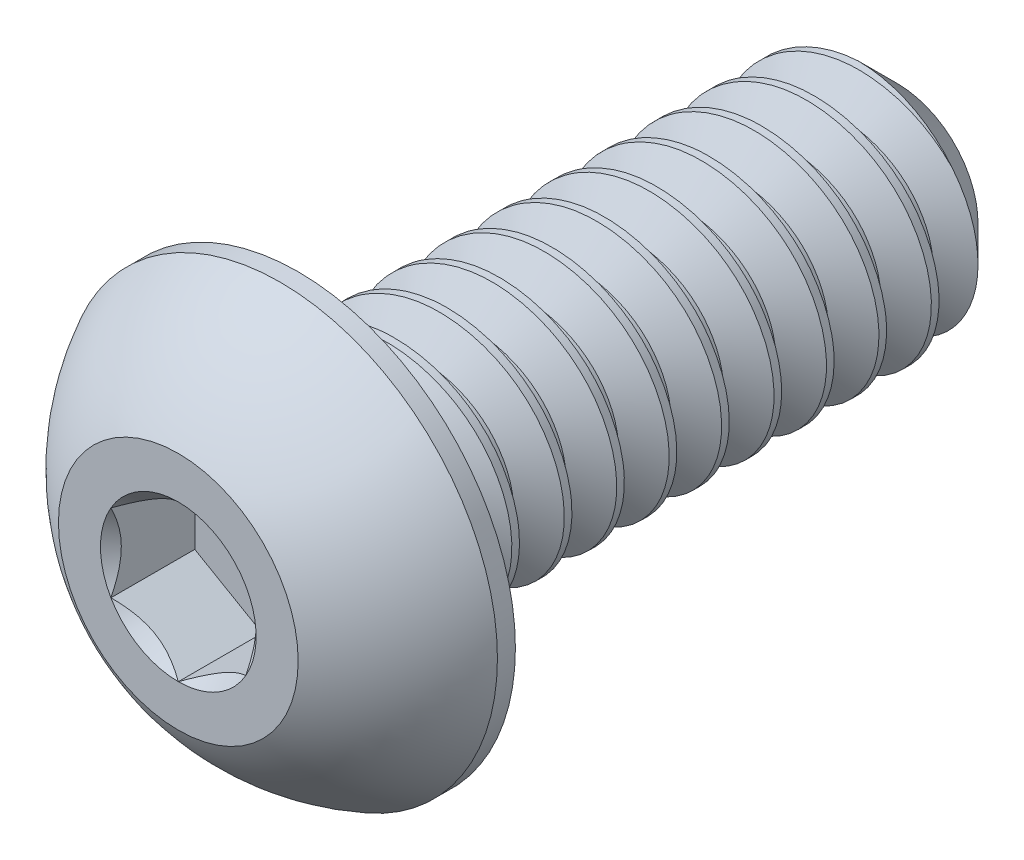
from build123d import *

# Parameters (mm, degrees)
SKETCH1_W          = 4
SKETCH1_H          = 0.8
CHAMFER1_SIZE      = 0.2625
CUT_EXTRUDE2_DEPTH = 0.56
CUT_SWEEP1_PITCH   = 0.35


with BuildPart() as part:
    # Sketch1 → Revolve1 (revolve)
    with BuildSketch(Plane(origin=(0, 0, 0), x_dir=(0, 0, -1), z_dir=(1, 0, 0))):
        with Locations((2.8, 0.4)):
            Rectangle(SKETCH1_W, SKETCH1_H)
    revolve(axis=Axis((0, 0, -4.8), (0, 0, 1)))

    # Chamfer1
    chamfer1_edges = [part.edges().sort_by_distance(p)[0] for p in [
        (0, -0.8, -4.8),
    ]]
    chamfer(chamfer1_edges, length=CHAMFER1_SIZE)

    # Sketch7 → Revolve2 (revolve)
    with BuildSketch(Plane(origin=(0, 0, 0), x_dir=(0, 0, -1), z_dir=(1, 0, 0)), mode=Mode.PRIVATE) as revolve2_sk:
        with BuildLine():
            Line((0.68, 1.45), (0.8, 1.45))
            Line((0.8, 1.45), (0.8, 0))
            Line((0.8, 0), (0, 0))
            Line((0, 0), (0, 0.8))
            ThreePointArc((0, 0.8), (0.291961854, 1.175255291), (0.68, 1.45))
        make_face()
    revolve(revolve2_sk.sketch.rotate(Axis((0, 0, 0), (0, 0, -1)), 180), axis=Axis((0, 0, 0), (0, 0, -1)))

    # Sketch5 → Cut-Extrude2 (cut)
    with BuildSketch(Plane.XY):
        Polygon((0.45, -0.259807621), (0.45, 0.259807621), (0, 0.519615242), (-0.45, 0.259807621), (-0.45, -0.259807621), (0, -0.519615242), align=None)
    extrude(amount=-CUT_EXTRUDE2_DEPTH, mode=Mode.SUBTRACT)

    # Cut-Extrude3 cone 1 section (through the dimple's axis) → Cut-Extrude3 (revolve, cut)
    with BuildSketch(Plane(origin=(0, 0, 0), x_dir=(0, -1, 0), z_dir=(1, 0, 0))):
        Polygon((0, 0), (0.519615242, 0), (0, 0.519615242), align=None)
    revolve(axis=Axis((0, 0, 0), (0, 0, -1)), mode=Mode.SUBTRACT)

    # Cut-Sweep1: the profile of Sketch2 profile screwed along a right-hand helix of 12.428571 turns, 6 arcs to a turn; built about Z, then put on its axis
    cut_sweep1_z = Axis((0, 0, 0), (0, 0, 1))
    cut_sweep1_corners = [(0.8003, 0, 0.262673205), (0.8003, 0, -0.036923205), (0.584792687, 0, 0.0875), (0.584792687, 0, 0.13825)]
    with BuildLine(mode=Mode.PRIVATE) as cut_sweep1_profile:
        Line(cut_sweep1_corners[0], cut_sweep1_corners[1])
        Line(cut_sweep1_corners[1], cut_sweep1_corners[2])
        Line(cut_sweep1_corners[2], cut_sweep1_corners[3])
        Line(cut_sweep1_corners[3], cut_sweep1_corners[0])
    cut_sweep1_cap = Face(cut_sweep1_profile.wire())
    cut_sweep1_turn_angles = [0, 30, 60, 90, 120, 150, 180, 210, 240, 270, 300, 330, 360]
    cut_sweep1_turn_weights = [1, 0.8660254037844387, 1, 0.8660254037844387, 1, 0.8660254037844387, 1, 0.8660254037844387, 1, 0.8660254037844387, 1, 0.8660254037844387, 1]
    cut_sweep1_turn_rails = [Edge.make_bspline([Vector(p[0], p[1], 0).rotate(cut_sweep1_z, cut_sweep1_turn_angles[k]) / cut_sweep1_turn_weights[k] + Vector(0, 0, p[2] + CUT_SWEEP1_PITCH * cut_sweep1_turn_angles[k] / 360) for k in range(13)], [0, 0, 0, 1, 1, 2, 2, 3, 3, 4, 4, 5, 5, 6, 6, 6], 2, cut_sweep1_turn_weights) for p in cut_sweep1_corners]
    cut_sweep1_turn_sides = [Face.make_surface_from_curves(cut_sweep1_turn_rails[p[0]], cut_sweep1_turn_rails[p[1]]) for p in [(0, 1), (1, 2), (2, 3), (3, 0)]]
    cut_sweep1_last_angles = [4320, 4350, 4380, 4410, 4440, 4457.142857143, 4474.285714286]
    cut_sweep1_last_weights = [1, 0.8660254037844387, 1, 0.8660254037844387, 1, 0.9555728057861187, 1]
    cut_sweep1_last_rails = [Edge.make_bspline([Vector(p[0], p[1], 0).rotate(cut_sweep1_z, cut_sweep1_last_angles[k]) / cut_sweep1_last_weights[k] + Vector(0, 0, p[2] + CUT_SWEEP1_PITCH * cut_sweep1_last_angles[k] / 360) for k in range(7)], [0, 0, 0, 1, 1, 2, 2, 3, 3, 3], 2, cut_sweep1_last_weights) for p in cut_sweep1_corners]
    cut_sweep1_last_sides = [Face.make_surface_from_curves(cut_sweep1_last_rails[p[0]], cut_sweep1_last_rails[p[1]]) for p in [(0, 1), (1, 2), (2, 3), (3, 0)]]
    cut_sweep1 = Plane(origin=(0, 0, -4.8), x_dir=(0, 1, 0), z_dir=(0, 0, 1)) * Solid(Shell([*[p.moved(Location((0, 0, CUT_SWEEP1_PITCH * i))) for i in range(12) for p in cut_sweep1_turn_sides], *cut_sweep1_last_sides, cut_sweep1_cap, cut_sweep1_cap.rotate(cut_sweep1_z, 4474.285714286).moved(Location((0, 0, CUT_SWEEP1_PITCH * 4474.285714286 / 360)))]))
    add(cut_sweep1, mode=Mode.SUBTRACT)


solid = part.part
